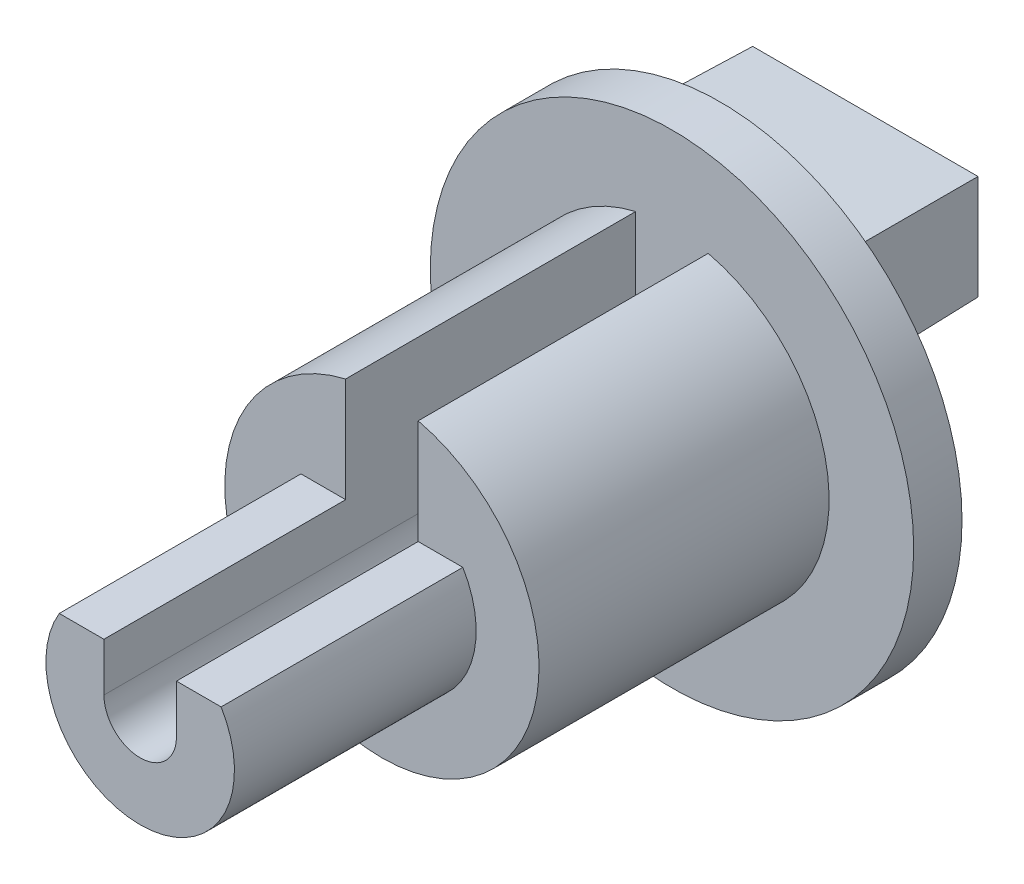
from build123d import *

# Parameters (mm, degrees)
STOCK_5_GEAR_5_OUTPUT_GEAR_32TEETH_0_5M_DEPTH = 6
STOCK_5_GEAR_START                            = 6
STOCK_5_GEAR_5_OUTPUT_GEAR_32TEETH_3_DEPTH    = 5
SKETCH1_W                                     = 2.3
SKETCH1_H                                     = 6.8
BOSS_EXTRUDE1_DEPTH                           = 4
BOSS_EXTRUDE1_DRAFT                           = 1
SKETCH1_W_2                                   = 4.8
SKETCH1_H_2                                   = 2.3
BOSS_EXTRUDE1_PROFILE_2_DEPTH                 = 4
BOSS_EXTRUDE1_PROFILE_2_DRAFT                 = 1
SKETCH2_R                                     = 5
BOSS_EXTRUDE2_DEPTH                           = 1


# Read off the part's stored shape, not the designer's step: Stock-5_Gear 5__Output Gear_32Teeth_0.5Modulus-1
with BuildPart() as part:
    # Stock-5_Gear 5__Output Gear_32Teeth_ 2 → Stock-5_Gear 5__Output Gear_32Teeth_0.5Modulus-1 (new body)
    with BuildSketch(Plane.XY):
        with BuildLine():
            ThreePointArc((-0.75, 3.16227766), (0, -3.25), (0.75, 3.16227766))
            Line((0.75, 3.16227766), (0.75, 0))
            ThreePointArc((0.75, 0), (0, -0.75), (-0.75, 0))
            Line((-0.75, 0), (-0.75, 3.16227766))
        make_face()
    extrude(amount=STOCK_5_GEAR_5_OUTPUT_GEAR_32TEETH_0_5M_DEPTH)

    # Stock-5_Gear 5__Output Gear_32Teeth_ 3 o → Stock-5_Gear 5__Output Gear_32Teeth_ 3 (add)
    with BuildSketch(Plane.XY.offset(STOCK_5_GEAR_START)):
        with BuildLine():
            Line((1.674066904, 1), (0.75, 1))
            Line((0.75, 1), (0.75, 0))
            ThreePointArc((0.75, 0), (0, -0.75), (-0.75, 0))
            Line((-0.75, 0), (-0.75, 1))
            Line((-0.75, 1), (-1.674066904, 1))
            ThreePointArc((-1.674066904, 1), (0, -1.95), (1.674066904, 1))
        make_face()
    extrude(amount=STOCK_5_GEAR_5_OUTPUT_GEAR_32TEETH_3_DEPTH)


with BuildPart() as boss_extrude1_tool:
    # Sketch1 → Boss-Extrude1 (with draft: the straight prism first)
    with BuildSketch(Plane(origin=(0, 0, 0), x_dir=(-1, 0, 0), z_dir=(0, 0, -1))):
        Rectangle(SKETCH1_W, SKETCH1_H)
    extrude(amount=BOSS_EXTRUDE1_DEPTH)
    # Boss-Extrude1: the draft: its side faces are tilted about the plane it starts from
    boss_extrude1_sides = [boss_extrude1_tool.faces().sort_by_distance(p)[0] for p in [
        (0, -3.4, -2),
        (-1.15, 0, -2),
        (0, 3.4, -2),
        (1.15, 0, -2),
    ]]
    draft(boss_extrude1_sides, Plane(origin=(0, 0, 0), x_dir=(-1, 0, 0), z_dir=(0, 0, -1)), BOSS_EXTRUDE1_DRAFT)


with BuildPart() as part_1:
    add(part.part)

    # Boss-Extrude1: add boss_extrude1_tool
    add(boss_extrude1_tool.part)


with BuildPart() as boss_extrude1_profile_2_tool:
    # Sketch1 → Boss-Extrude1 profile 2 (with draft: the straight prism first)
    with BuildSketch(Plane(origin=(0, 0, 0), x_dir=(-1, 0, 0), z_dir=(0, 0, -1))):
        with Locations((0, 2.25)):
            Rectangle(SKETCH1_W_2, SKETCH1_H_2)
    extrude(amount=BOSS_EXTRUDE1_PROFILE_2_DEPTH)
    # Boss-Extrude1 profile 2: the draft: its side faces are tilted about the plane it starts from
    boss_extrude1_profile_2_sides = [boss_extrude1_profile_2_tool.faces().sort_by_distance(p)[0] for p in [
        (0, 3.4, -2),
        (2.4, 2.25, -2),
        (0, 1.1, -2),
        (-2.4, 2.25, -2),
    ]]
    draft(boss_extrude1_profile_2_sides, Plane(origin=(0, 0, 0), x_dir=(-1, 0, 0), z_dir=(0, 0, -1)), BOSS_EXTRUDE1_PROFILE_2_DRAFT)


with BuildPart() as part_2:
    add(part_1.part)

    # Boss-Extrude1 profile 2: add boss_extrude1_profile_2_tool
    add(boss_extrude1_profile_2_tool.part)

    # Sketch2 → Boss-Extrude2 (add)
    with BuildSketch(Plane(origin=(0, 0, 0), x_dir=(-1, 0, 0), z_dir=(0, 0, -1))):
        Circle(SKETCH2_R)
    extrude(amount=BOSS_EXTRUDE2_DEPTH)


solid = part_2.part
